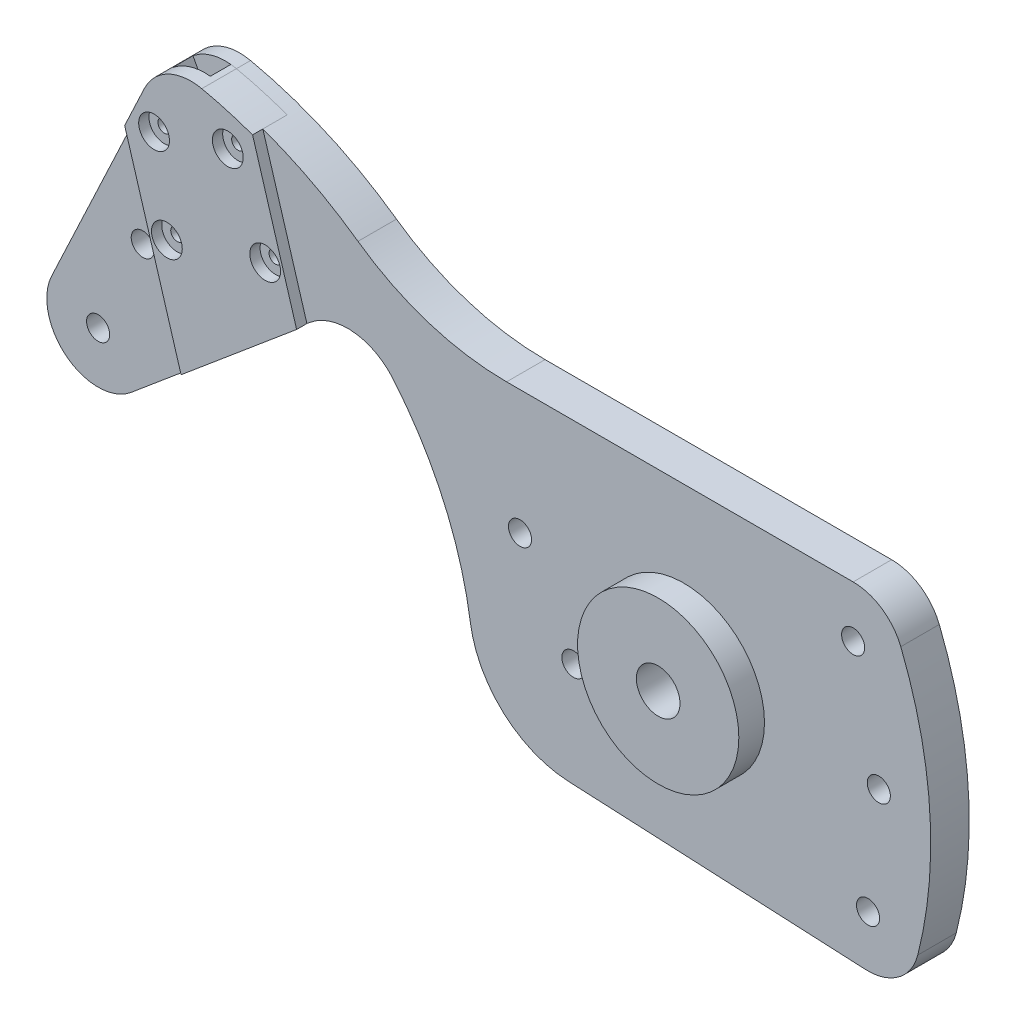
from build123d import *

# Parameters (mm, degrees)
SKETCH1_R              = 2.25
SKETCH1_R_2            = 4.25
BOSS_EXTRUDE1_DEPTH    = 4.75
CUT_EXTRUDE1_DEPTH     = 2
SKETCH4_R              = 1.25
CUT_EXTRUDE2_DEPTH     = 136.849086626
SKETCH5_R              = 3
CUT_EXTRUDE3_DEPTH     = 2
SPLIT3_SURFACE_1_BACK  = 193.818
SPLIT3_SURFACE_1_DEPTH = 387.636
SPLIT3_SURFACE_2_BACK  = 193.818
SPLIT3_SURFACE_2_DEPTH = 387.636
SKETCH6_R              = 15.710018396
CUT_EXTRUDE4_DEPTH     = 2
SKETCH7_R              = 15.710018396
SKETCH7_R_2            = 4.25
BOSS_EXTRUDE2_DEPTH    = 3


with BuildPart() as part:
    # Sketch1 → Boss-Extrude1 (new, symmetric)
    with BuildSketch(Plane.XY):
        with BuildLine():
            Line((-22.500230832, -28.983987123), (35.398437983, -31.788291003))
            ThreePointArc((35.398437983, -31.788291003), (41.825152283, -29.842482755), (45.572267137, -24.270413418))
            ThreePointArc((45.572267137, -24.270413418), (47.922199842, 1.185089324), (42.266415188, 26.115330067))
            ThreePointArc((42.266415188, 26.115330067), (38.587871094, 30.681102), (32.982217728, 32.4))
            Line((32.982217728, 32.4), (-34.53815208, 32.4))
            ThreePointArc((-34.53815208, 32.4), (-49.730929753, 34.764094355), (-63.487021029, 41.632819737))
            ThreePointArc((-63.487021029, 41.632819737), (-77.067258547, 49.344582351), (-91.918742124, 54.174444589))
            ThreePointArc((-91.918742124, 54.174444589), (-98.466295495, 53.366674665), (-103.085929893, 48.656905518))
            Line((-103.085929893, 48.656905518), (-123.167077545, 5.955614534))
            ThreePointArc((-123.167077545, 5.955614534), (-120.218280198, -6.2236308), (-107.689906175, -5.960444431))
            Line((-107.689906175, -5.960444431), (-72.864818345, 23.261273923))
            ThreePointArc((-72.864818345, 23.261273923), (-64.470178387, 25.908093735), (-56.662687309, 21.843771132))
            ThreePointArc((-56.662687309, 21.843771132), (-46.809939593, 6.135423294), (-41.608278072, -11.662653759))
            ThreePointArc((-41.608278072, -11.662653759), (-35.156858245, -23.745961099), (-22.500230832, -28.983987123))
        make_face()
        with Locations((35.882217728, -21.8)):
            Circle(SKETCH1_R, mode=Mode.SUBTRACT)
        with Locations((-21.517782272, -8.7)):
            Circle(SKETCH1_R, mode=Mode.SUBTRACT)
        Circle(SKETCH1_R_2, mode=Mode.SUBTRACT)
        with Locations((-31.917782272, 8.2)):
            Circle(SKETCH1_R, mode=Mode.SUBTRACT)
        with Locations((37.982217728, -0.1)):
            Circle(SKETCH1_R, mode=Mode.SUBTRACT)
        with Locations((32.982217728, 22.4)):
            Circle(SKETCH1_R, mode=Mode.SUBTRACT)
        with Locations((-105.417782272, 20.2)):
            Circle(SKETCH1_R, mode=Mode.SUBTRACT)
        with Locations((-114.117782272, 1.7)):
            Circle(SKETCH1_R, mode=Mode.SUBTRACT)
    extrude(amount=BOSS_EXTRUDE1_DEPTH, both=True)

    # Sketch2 → Cut-Extrude1 (cut, symmetric)
    with BuildSketch(Plane.XY):
        with BuildLine():
            Line((-78.227129447, 18.761760655), (-92.084556702, 44.987885053))
            Line((-92.084556702, 44.987885053), (-93.002217677, 54.347646176))
            ThreePointArc((-93.002217677, 54.347646176), (-96.914482214, 53.978242129), (-100.382341665, 52.129939126))
            Line((-100.382341665, 52.129939126), (-95.988712538, 43.814696915))
            Line((-95.988712538, 43.814696915), (-92.369017313, 6.895307763))
            Line((-92.369017313, 6.895307763), (-78.227129447, 18.761760655))
        make_face()
    extrude(amount=CUT_EXTRUDE1_DEPTH, both=True, mode=Mode.SUBTRACT)

    # Sketch4 → Cut-Extrude2 (cut, through all)
    with BuildSketch(Plane.XY.offset(4.75)):
        with Locations((-98.721244854, 25.242626445)):
            Circle(SKETCH4_R)
        with Locations((-101.219347979, 42.242905289)):
            Circle(SKETCH4_R)
        with Locations((-86.853921262, 46.55967668)):
            Circle(SKETCH4_R)
        with Locations((-79.567342565, 30.998321633)):
            Circle(SKETCH4_R)
    extrude(amount=-CUT_EXTRUDE2_DEPTH, mode=Mode.SUBTRACT)

    # Sketch5 → Cut-Extrude3 (cut)
    with BuildSketch(Plane.XY.offset(4.75)):
        with Locations((-101.219347979, 42.242905289)):
            Circle(SKETCH5_R)
        with Locations((-86.853921262, 46.55967668)):
            Circle(SKETCH5_R)
        with Locations((-79.567342565, 30.998321633)):
            Circle(SKETCH5_R)
        with Locations((-98.721244854, 25.242626445)):
            Circle(SKETCH5_R)
    extrude(amount=-CUT_EXTRUDE3_DEPTH, mode=Mode.SUBTRACT)


with BuildPart() as body_2:
    # Split3: the piece behind the surface
    add(part.part)
    # Split3 surface: a surface, the sketch's curves swept straight by 387.636 mm
    with BuildLine(Plane(origin=(-20.02556284, 66.641415389, 0), x_dir=(0.9576951144500195, 0.2877847594271872, 0), z_dir=(-0.2877847594271872, 0.9576951144500195, 0)).offset(-SPLIT3_SURFACE_1_BACK), mode=Mode.PRIVATE) as split3_surface_1_path:
        Line((-63.780410711, -4.75), (-63.780410711, 2))
        Line((-63.780410711, 2), (-90.780410711, 2))
        Line((-90.780410711, 2), (-90.780410711, -4.75))
    split3_surface_1 = Shell.extrude(split3_surface_1_path.wire(), (-0.287784759 * SPLIT3_SURFACE_1_DEPTH, 0.957695114 * SPLIT3_SURFACE_1_DEPTH, 0 * SPLIT3_SURFACE_1_DEPTH))
    split(bisect_by=split3_surface_1, keep=Keep.BOTTOM)

    # Sketch6 → Cut-Extrude4 (cut)
    # profile 1 of 2: a face of its own
    with BuildSketch(Plane.XY.offset(4.75)):
        with BuildLine():
            Line((-95.957666069, 3.884073915), (-106.945535827, 40.449697498))
            Line((-106.945535827, 40.449697498), (-123.167077545, 5.955614534))
            ThreePointArc((-123.167077545, 5.955614534), (-120.218280198, -6.2236308), (-107.689906175, -5.960444431))
            Line((-107.689906175, -5.960444431), (-95.957666069, 3.884073915))
        make_face()
    # profile 2 of 2: a face of its own
    with BuildSketch(Plane.XY.offset(4.75)):
        with BuildLine():
            Line((-82.022097036, 51.329163249), (-73.442190431, 22.776801219))
            Line((-73.442190431, 22.776801219), (-72.864818345, 23.261273923))
            ThreePointArc((-72.864818345, 23.261273923), (-64.470178387, 25.908093735), (-56.662687309, 21.843771132))
            ThreePointArc((-56.662687309, 21.843771132), (-46.809939593, 6.135423294), (-41.608278072, -11.662653759))
            ThreePointArc((-41.608278072, -11.662653759), (-35.156858245, -23.745961099), (-22.500230832, -28.983987123))
            Line((-22.500230832, -28.983987123), (35.398437983, -31.788291003))
            ThreePointArc((35.398437983, -31.788291003), (41.825152283, -29.842482755), (45.572267137, -24.270413418))
            ThreePointArc((45.572267137, -24.270413418), (47.922199842, 1.185089324), (42.266415188, 26.115330067))
            ThreePointArc((42.266415188, 26.115330067), (38.587871094, 30.681102), (32.982217728, 32.4))
            Line((32.982217728, 32.4), (-34.53815208, 32.4))
            ThreePointArc((-34.53815208, 32.4), (-49.730929753, 34.764094355), (-63.487021029, 41.632819737))
            ThreePointArc((-63.487021029, 41.632819737), (-72.425615765, 47.109784033), (-82.022097036, 51.329163249))
        make_face()
        Circle(SKETCH6_R, mode=Mode.SUBTRACT)
    extrude(amount=-CUT_EXTRUDE4_DEPTH, mode=Mode.SUBTRACT)

    # Sketch7 → Boss-Extrude2 (add)
    with BuildSketch(Plane.XY.offset(4.75)):
        Circle(SKETCH7_R)
        Circle(SKETCH7_R_2, mode=Mode.SUBTRACT)
    extrude(amount=BOSS_EXTRUDE2_DEPTH)


with BuildPart() as part_1:
    add(part.part)

    # Split3: split by a surface, the side it looks to stays
    # Split3 surface: a surface, the sketch's curves swept straight by 387.636 mm
    with BuildLine(Plane(origin=(-20.02556284, 66.641415389, 0), x_dir=(0.9576951144500195, 0.2877847594271872, 0), z_dir=(-0.2877847594271872, 0.9576951144500195, 0)).offset(-SPLIT3_SURFACE_2_BACK), mode=Mode.PRIVATE) as split3_surface_2_path:
        Line((-63.780410711, -4.75), (-63.780410711, 2))
        Line((-63.780410711, 2), (-90.780410711, 2))
        Line((-90.780410711, 2), (-90.780410711, -4.75))
    split3_surface_2 = Shell.extrude(split3_surface_2_path.wire(), (-0.287784759 * SPLIT3_SURFACE_2_DEPTH, 0.957695114 * SPLIT3_SURFACE_2_DEPTH, 0 * SPLIT3_SURFACE_2_DEPTH))
    split(bisect_by=split3_surface_2, keep=Keep.TOP)


solid = Compound([body_2.part, part_1.part])
